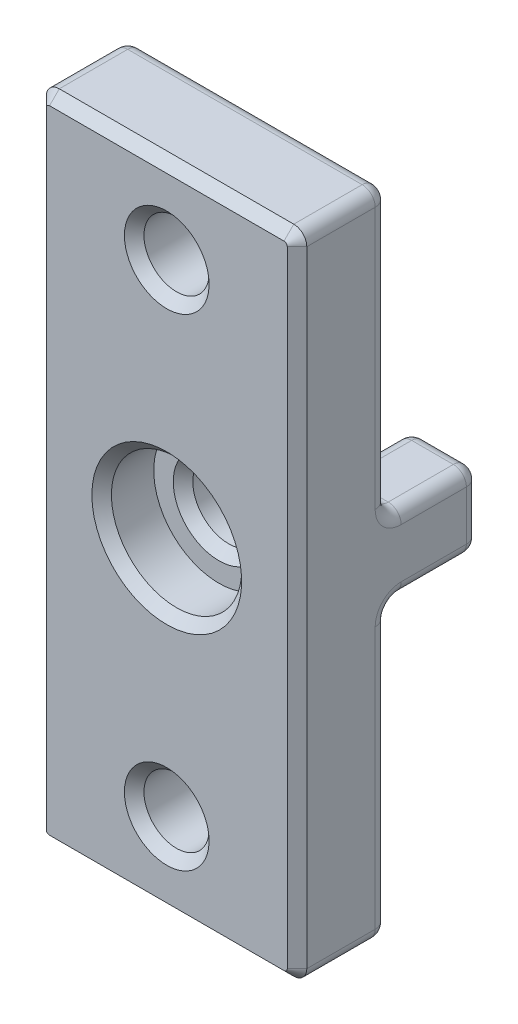
from build123d import *

# Parameters (mm, degrees)
EXTRUDE_1_DEPTH     = 7
EXTRUDE_1_2_DEPTH   = 7
EXTRUDE_1_3_DEPTH   = 7
EXTRUDE_1_4_DEPTH   = 7
SKETCH_3_R          = 2.75
SKETCH_3_R_2        = 2.4999999999999996
EXTRUDE_2_DEPTH     = 7
FILLET_1_R          = 1
SKETCH_5_R          = 5
CUT_EXTRUDE_2_DEPTH = 4
CHAMFER_1_SIZE      = 0.75


with BuildPart() as part:
    # Эскиз2 → Бобышка-Вытянуть1 (new body)
    with BuildSketch(Plane.XY):
        Polygon((-2.9, 10), (-2.8999999999999995, 4.800000000000013), (2.9000000000000004, 4.800000000000014), (2.9, 10), align=None)
    extrude(amount=-EXTRUDE_1_DEPTH)



with BuildPart() as body_2:
    # Эскиз2 → Extrude 1 2 (new body)
    with BuildSketch(Plane.XY):
        Polygon((10, 2.9000000000000004), (4.800000000000012, 2.9), (4.800000000000014, -2.9), (10, -2.8999999999999995), align=None)
    extrude(amount=-EXTRUDE_1_2_DEPTH)


with BuildPart() as body_3:
    # Эскиз2 → Extrude 1 3 (new body)
    with BuildSketch(Plane.XY):
        Polygon((2.9000000000000012, -10), (2.9000000000000004, -4.800000000000012), (-2.9, -4.800000000000014), (-2.8999999999999986, -10), align=None)
    extrude(amount=-EXTRUDE_1_3_DEPTH)


with BuildPart() as body_4:
    # Эскиз2 → Extrude 1 4 (new body)
    with BuildSketch(Plane.XY):
        Polygon((-10, -2.9000000000000017), (-4.800000000000012, -2.9000000000000004), (-4.800000000000015, 2.8999999999999995), (-10, 2.899999999999998), align=None)
    extrude(amount=-EXTRUDE_1_4_DEPTH)


with BuildPart() as part_1:
    add(part.part)

    add(body_2.part)  # Бобышка-Вытянуть2 merges body 2

    add(body_3.part)  # Бобышка-Вытянуть2 merges body 3

    add(body_4.part)  # Бобышка-Вытянуть2 merges body 4
    # Эскиз3 → Бобышка-Вытянуть2 (add)
    with BuildSketch(Plane.XY):
        with BuildLine():
            Line((-10.00000014901159, 24), (-10.000000149011584, -23.999999999999993))
            ThreePointArc((-10.000000149011584, -23.999999999999993), (-9.707106930198131, -24.70710678118654), (-9.000000149011584, -24.99999999999999))
            Line((-9.000000149011584, -24.99999999999999), (9.00000014901158, -24.99999999999999))
            ThreePointArc((9.00000014901158, -24.99999999999999), (9.707106930198124, -24.70710678118654), (10.00000014901158, -23.999999999999993))
            Line((10.00000014901158, -23.999999999999993), (10.000000149011589, 24))
            ThreePointArc((10.000000149011589, 24), (9.707106930198133, 24.707106781186546), (9.000000149011585, 25))
            Line((9.000000149011585, 25), (-9.000000149011589, 25))
            ThreePointArc((-9.000000149011589, 25), (-9.707106930198137, 24.70710678118655), (-10.00000014901159, 24))
        make_face()
        Circle(SKETCH_3_R, mode=Mode.SUBTRACT)
        with Locations((0, 18.500000000000004)):
            Circle(SKETCH_3_R_2, mode=Mode.SUBTRACT)
        with Locations(Location((0, -18.499999999999996, 0), (0, 0, 180))):
            Circle(SKETCH_3_R_2, mode=Mode.SUBTRACT)
    extrude(amount=EXTRUDE_2_DEPTH)

    # Скругление1
    # the kernel refuses this fillet: 1 mm, written as the material it takes off along each edge
    with BuildSketch(Plane(origin=(5.800000000000012, 1.9, -6), x_dir=(-1, -3.1e-16, 0), z_dir=(-9e-17, 1, 0))) as fillet_1_piece_1_section:
        Polygon((0, 0), (FILLET_1_R, 0), (FILLET_1_R, -FILLET_1_R), (0, -FILLET_1_R), align=None)
    fillet_1_piece_1 = extrude(amount=FILLET_1_R, mode=Mode.PRIVATE)
    fillet_1_piece_1 = fillet_1_piece_1 - Plane(origin=(5.800000000000012, 1.9, -6), x_dir=(0.7071067811865475, 0, 0.7071067811865475), z_dir=(-9e-17, 1, 0)) * Sphere(FILLET_1_R, mode=Mode.PRIVATE)
    add(fillet_1_piece_1, mode=Mode.SUBTRACT)
    with BuildSketch(Plane(origin=(5.800000000000014, -1.9000000000000006, -6), x_dir=(9e-17, -1, 0), z_dir=(-1, -3.1e-16, 0))) as fillet_1_piece_2_section:
        Polygon((0, 0), (FILLET_1_R, 0), (FILLET_1_R, -FILLET_1_R), (0, -FILLET_1_R), align=None)
    fillet_1_piece_2 = extrude(amount=FILLET_1_R, mode=Mode.PRIVATE)
    fillet_1_piece_2 = fillet_1_piece_2 - Plane(origin=(5.800000000000014, -1.9000000000000006, -6), x_dir=(0, 0.7071067811865475, 0.7071067811865475), z_dir=(-1, -3.1e-16, 0)) * Sphere(FILLET_1_R, mode=Mode.PRIVATE)
    add(fillet_1_piece_2, mode=Mode.SUBTRACT)
    with BuildSketch(Plane(origin=(1.9000000000000012, -9, -6), x_dir=(0, -1, 0), z_dir=(1, 1.7e-16, 0))) as fillet_1_piece_3_section:
        Polygon((0, 0), (FILLET_1_R, 0), (FILLET_1_R, FILLET_1_R), (0, FILLET_1_R), align=None)
    fillet_1_piece_3 = extrude(amount=FILLET_1_R, mode=Mode.PRIVATE)
    fillet_1_piece_3 = fillet_1_piece_3 - Plane(origin=(1.9000000000000012, -9, -6), x_dir=(0, 0.7071067811865475, 0.7071067811865475), z_dir=(1, 1.7e-16, 0)) * Sphere(FILLET_1_R, mode=Mode.PRIVATE)
    add(fillet_1_piece_3, mode=Mode.SUBTRACT)
    with BuildSketch(Plane(origin=(1.9000000000000004, -5.800000000000013, -6), x_dir=(-3.1e-16, 1, 0), z_dir=(1, 1.7e-16, 0))) as fillet_1_piece_4_section:
        Polygon((0, 0), (FILLET_1_R, 0), (FILLET_1_R, -FILLET_1_R), (0, -FILLET_1_R), align=None)
    fillet_1_piece_4 = extrude(amount=FILLET_1_R, mode=Mode.PRIVATE)
    fillet_1_piece_4 = fillet_1_piece_4 - Plane(origin=(1.9000000000000004, -5.800000000000013, -6), x_dir=(0, -0.7071067811865475, 0.7071067811865475), z_dir=(1, 1.7e-16, 0)) * Sphere(FILLET_1_R, mode=Mode.PRIVATE)
    add(fillet_1_piece_4, mode=Mode.SUBTRACT)
    with BuildSketch(Plane(origin=(-1.9000000000000001, -5.800000000000014, -6), x_dir=(-1, -2.6e-16, 0), z_dir=(-3.1e-16, 1, 0))) as fillet_1_piece_5_section:
        Polygon((0, 0), (FILLET_1_R, 0), (FILLET_1_R, -FILLET_1_R), (0, -FILLET_1_R), align=None)
    fillet_1_piece_5 = extrude(amount=FILLET_1_R, mode=Mode.PRIVATE)
    fillet_1_piece_5 = fillet_1_piece_5 - Plane(origin=(-1.9000000000000001, -5.800000000000014, -6), x_dir=(0.7071067811865475, 0, 0.7071067811865475), z_dir=(-3.1e-16, 1, 0)) * Sphere(FILLET_1_R, mode=Mode.PRIVATE)
    add(fillet_1_piece_5, mode=Mode.SUBTRACT)
    with BuildSketch(Plane(origin=(-1.8999999999999988, -9, -6), x_dir=(-1, -2.6e-16, 0), z_dir=(0, -1, 0))) as fillet_1_piece_6_section:
        Polygon((0, 0), (FILLET_1_R, 0), (FILLET_1_R, FILLET_1_R), (0, FILLET_1_R), align=None)
    fillet_1_piece_6 = extrude(amount=FILLET_1_R, mode=Mode.PRIVATE)
    fillet_1_piece_6 = fillet_1_piece_6 - Plane(origin=(-1.8999999999999988, -9, -6), x_dir=(0.7071067811865475, 0, 0.7071067811865475), z_dir=(0, -1, 0)) * Sphere(FILLET_1_R, mode=Mode.PRIVATE)
    add(fillet_1_piece_6, mode=Mode.SUBTRACT)
    with BuildSketch(Plane(origin=(-5.800000000000015, 1.899999999999999, -6), x_dir=(0, 0, -1), z_dir=(-2.6e-16, 1, 0))) as fillet_1_piece_7_section:
        Polygon((0, 0), (FILLET_1_R, 0), (FILLET_1_R, -FILLET_1_R), (0, -FILLET_1_R), align=None)
    fillet_1_piece_7 = extrude(amount=FILLET_1_R, mode=Mode.PRIVATE)
    fillet_1_piece_7 = fillet_1_piece_7 - Plane(origin=(-5.800000000000015, 1.899999999999999, -6), x_dir=(-0.7071067811865475, 0, 0.7071067811865475), z_dir=(-2.6e-16, 1, 0)) * Sphere(FILLET_1_R, mode=Mode.PRIVATE)
    add(fillet_1_piece_7, mode=Mode.SUBTRACT)
    with BuildSketch(Plane(origin=(-5.800000000000013, -1.9000000000000006, -6), x_dir=(2.6e-16, -1, 0), z_dir=(0, 0, -1))) as fillet_1_piece_8_section:
        Polygon((0, 0), (FILLET_1_R, 0), (FILLET_1_R, -FILLET_1_R), (-2e-16, -FILLET_1_R), align=None)
    fillet_1_piece_8 = extrude(amount=FILLET_1_R, mode=Mode.PRIVATE)
    fillet_1_piece_8 = fillet_1_piece_8 - Plane(origin=(-5.800000000000013, -1.9000000000000006, -6), x_dir=(-0.7071067811865478, 0.7071067811865472, 0), z_dir=(0, 0, -1)) * Sphere(FILLET_1_R, mode=Mode.PRIVATE)
    add(fillet_1_piece_8, mode=Mode.SUBTRACT)
    with BuildSketch(Plane(origin=(-1.9, 9, -6), x_dir=(0, 1, 0), z_dir=(0, 0, -1))) as fillet_1_piece_9_section:
        Polygon((0, 0), (FILLET_1_R, 0), (FILLET_1_R, -FILLET_1_R), (-9e-17, -FILLET_1_R), align=None)
    fillet_1_piece_9 = extrude(amount=FILLET_1_R, mode=Mode.PRIVATE)
    fillet_1_piece_9 = fillet_1_piece_9 - Plane(origin=(-1.9, 9, -6), x_dir=(0.7071067811865476, -0.7071067811865475, 0), z_dir=(0, 0, -1)) * Sphere(FILLET_1_R, mode=Mode.PRIVATE)
    add(fillet_1_piece_9, mode=Mode.SUBTRACT)
    with BuildSketch(Plane(origin=(-1.8999999999999995, 5.800000000000013, -6), x_dir=(1.5e-16, -1, 0), z_dir=(0, 0, -1))) as fillet_1_piece_10_section:
        Polygon((0, 0), (FILLET_1_R, 0), (FILLET_1_R, FILLET_1_R), (-7e-17, FILLET_1_R), align=None)
    fillet_1_piece_10 = extrude(amount=FILLET_1_R, mode=Mode.PRIVATE)
    fillet_1_piece_10 = fillet_1_piece_10 - Plane(origin=(-1.8999999999999995, 5.800000000000013, -6), x_dir=(0.7071067811865475, 0.7071067811865476, 0), z_dir=(0, 0, -1)) * Sphere(FILLET_1_R, mode=Mode.PRIVATE)
    add(fillet_1_piece_10, mode=Mode.SUBTRACT)
    with BuildSketch(Plane(origin=(1.9000000000000004, 5.800000000000014, -6), x_dir=(1.5e-16, -1, 0), z_dir=(0, 0, -1))) as fillet_1_piece_11_section:
        Polygon((0, 0), (FILLET_1_R, 0), (FILLET_1_R, -FILLET_1_R), (7e-17, -FILLET_1_R), align=None)
    fillet_1_piece_11 = extrude(amount=FILLET_1_R, mode=Mode.PRIVATE)
    fillet_1_piece_11 = fillet_1_piece_11 - Plane(origin=(1.9000000000000004, 5.800000000000014, -6), x_dir=(-0.7071067811865477, 0.7071067811865474, 0), z_dir=(0, 0, -1)) * Sphere(FILLET_1_R, mode=Mode.PRIVATE)
    add(fillet_1_piece_11, mode=Mode.SUBTRACT)
    with BuildSketch(Plane(origin=(1.9, 9, -6), x_dir=(0, 1, 0), z_dir=(0, 0, -1))) as fillet_1_piece_12_section:
        Polygon((0, 0), (FILLET_1_R, 0), (FILLET_1_R, FILLET_1_R), (9e-17, FILLET_1_R), align=None)
    fillet_1_piece_12 = extrude(amount=FILLET_1_R, mode=Mode.PRIVATE)
    fillet_1_piece_12 = fillet_1_piece_12 - Plane(origin=(1.9, 9, -6), x_dir=(-0.7071067811865475, -0.7071067811865475, 0), z_dir=(0, 0, -1)) * Sphere(FILLET_1_R, mode=Mode.PRIVATE)
    add(fillet_1_piece_12, mode=Mode.SUBTRACT)
    with BuildSketch(Plane(origin=(10, -5.3999999999999995, -7), x_dir=(0, 0, 1), z_dir=(0, 1, 0)), Plane(origin=(-10, 5.399999999999999, -7), x_dir=(0, 0, 1), z_dir=(0, -1, 0))) as fillet_1_piece_13:
        with BuildLine():
            CenterArc((FILLET_1_R, -FILLET_1_R), FILLET_1_R, 90, 90)
            Line((0, -FILLET_1_R), (0, 0))
            Line((0, 0), (FILLET_1_R, 0))
        make_face()
    extrude(amount=10.8, mode=Mode.SUBTRACT)
    with BuildSketch(Plane(origin=(12.5, 2.9000000000000004, -7), x_dir=(0, 0, 1), z_dir=(-1, -9e-17, 0)), Plane(origin=(-12.5, -2.900000000000002, -7), x_dir=(0, 0, 1), z_dir=(1, 2.6e-16, 0))) as fillet_1_piece_14:
        with BuildLine():
            CenterArc((FILLET_1_R, -FILLET_1_R), FILLET_1_R, 90, 90)
            Line((0, -FILLET_1_R), (0, 0))
            Line((0, 0), (FILLET_1_R, 0))
        make_face()
    extrude(amount=6.699999999999988, mode=Mode.SUBTRACT)
    with BuildSketch(Plane(origin=(0, -18.499999999999996, 0), x_dir=(-1, 0, 0), z_dir=(0, 1, 0))) as fillet_1_piece_15:
        with BuildLine():
            CenterArc((2.4999999999999996 + FILLET_1_R, FILLET_1_R), FILLET_1_R, 180, 90)
            Line((2.4999999999999996, FILLET_1_R), (2.4999999999999996, 0))
            Line((2.4999999999999996, 0), (2.4999999999999996 + FILLET_1_R, 0))
        make_face()
    revolve(axis=Axis((0, -18.499999999999996, 0), (0, 0, 1)), mode=Mode.SUBTRACT)
    with BuildSketch(Plane(origin=(0, 18.500000000000004, 0), x_dir=(1, 0, 0), z_dir=(0, -1, 0))) as fillet_1_piece_16:
        with BuildLine():
            CenterArc((2.4999999999999996 + FILLET_1_R, FILLET_1_R), FILLET_1_R, 180, 90)
            Line((2.4999999999999996, FILLET_1_R), (2.4999999999999996, 0))
            Line((2.4999999999999996, 0), (2.4999999999999996 + FILLET_1_R, 0))
        make_face()
    revolve(axis=Axis((0, 18.500000000000004, 0), (0, 0, 1)), mode=Mode.SUBTRACT)
    with BuildSketch(Plane(origin=(-1.73e-15, 3.47e-15, 0), x_dir=(1, 0, 0), z_dir=(0, -1, 0))) as fillet_1_piece_17:
        with BuildLine():
            CenterArc((2.75 + FILLET_1_R, FILLET_1_R), FILLET_1_R, 180, 90)
            Line((2.75, FILLET_1_R), (2.75, 0))
            Line((2.75, 0), (2.75 + FILLET_1_R, 0))
        make_face()
    revolve(axis=Axis((-1.73e-15, 3.47e-15, 0), (0, 0, 1)), mode=Mode.SUBTRACT)
    with BuildSketch(Plane(origin=(4.800000000000012, 1.8999999999999995, -7), x_dir=(0, 0, 1), z_dir=(3.1e-16, -1, 0))) as fillet_1_piece_18:
        with BuildLine():
            CenterArc((FILLET_1_R, -FILLET_1_R), FILLET_1_R, 90, 90)
            Line((0, -FILLET_1_R), (0, 0))
            Line((0, 0), (FILLET_1_R, 0))
        make_face()
    extrude(amount=3.8000000000000003, mode=Mode.SUBTRACT)
    with BuildSketch(Plane(origin=(2.9000000000000012, -9, -7), x_dir=(0, 0, 1), z_dir=(-1.7e-16, 1, 0))) as fillet_1_piece_19:
        with BuildLine():
            CenterArc((FILLET_1_R, -FILLET_1_R), FILLET_1_R, 90, 90)
            Line((0, -FILLET_1_R), (0, 0))
            Line((0, 0), (FILLET_1_R, 0))
        make_face()
    extrude(amount=3.1999999999999877, mode=Mode.SUBTRACT)
    with BuildSketch(Plane(origin=(2.9000000000000004, -4.800000000000012, 0), x_dir=(0, -1, 0), z_dir=(0, 0, -1))) as fillet_1_piece_20:
        with BuildLine():
            CenterArc((FILLET_1_R, FILLET_1_R), FILLET_1_R, 179.99999999999997, 90)
            Line((8.9e-16, FILLET_1_R), (0, 0))
            Line((0, 0), (FILLET_1_R, 0))
        make_face()
    extrude(amount=6, mode=Mode.SUBTRACT)
    with BuildSketch(Plane(origin=(2.9000000000000012, -10, 0), x_dir=(0, 1, 0), z_dir=(0, 0, -1)), Plane(origin=(-2.9, 10, 0), x_dir=(0, -1, 0), z_dir=(0, 0, -1))) as fillet_1_piece_21:
        with BuildLine():
            CenterArc((FILLET_1_R, -FILLET_1_R), FILLET_1_R, 90, 90)
            Line((0, -FILLET_1_R), (0, 0))
            Line((0, 0), (FILLET_1_R, 0))
        make_face()
    extrude(amount=6, mode=Mode.SUBTRACT)
    with BuildSketch(Plane(origin=(-2.8999999999999995, -5.800000000000014, -7), x_dir=(0, 0, 1), z_dir=(2.6e-16, -1, 0)), Plane(origin=(2.9000000000000004, 5.800000000000014, -7), x_dir=(0, 0, 1), z_dir=(-9e-17, 1, 0))) as fillet_1_piece_22:
        with BuildLine():
            CenterArc((FILLET_1_R, -FILLET_1_R), FILLET_1_R, 90, 90)
            Line((0, -FILLET_1_R), (0, 0))
            Line((0, 0), (FILLET_1_R, 0))
        make_face()
    extrude(amount=3.199999999999986, mode=Mode.SUBTRACT)
    with BuildSketch(Plane(origin=(-2.8999999999999986, -10, 0), x_dir=(1, 0, 0), z_dir=(0, 0, -1))) as fillet_1_piece_23:
        with BuildLine():
            CenterArc((FILLET_1_R, -FILLET_1_R), FILLET_1_R, 90, 90)
            Line((-4.4e-16, -FILLET_1_R), (0, 0))
            Line((0, 0), (FILLET_1_R, 0))
        make_face()
    extrude(amount=6, mode=Mode.SUBTRACT)
    with BuildSketch(Plane(origin=(1.9, -4.800000000000012, -7), x_dir=(0, 0, 1), z_dir=(-1, -3.1e-16, 0))) as fillet_1_piece_24:
        with BuildLine():
            CenterArc((FILLET_1_R, -FILLET_1_R), FILLET_1_R, 90, 90)
            Line((0, -FILLET_1_R), (0, 0))
            Line((0, 0), (FILLET_1_R, 0))
        make_face()
    extrude(amount=3.800000000000001, mode=Mode.SUBTRACT)
    with BuildSketch(Plane(origin=(-2.9, -4.800000000000014, 0), x_dir=(1, 0, 0), z_dir=(0, 0, -1))) as fillet_1_piece_25:
        with BuildLine():
            CenterArc((FILLET_1_R, FILLET_1_R), FILLET_1_R, 180, 90)
            Line((-4.4e-16, FILLET_1_R), (0, 0))
            Line((0, 0), (FILLET_1_R, 0))
        make_face()
    extrude(amount=6, mode=Mode.SUBTRACT)
    with BuildSketch(Plane(origin=(-1.899999999999999, -10, -7), x_dir=(0, 0, 1), z_dir=(1, 0, 0))) as fillet_1_piece_26:
        with BuildLine():
            CenterArc((FILLET_1_R, -FILLET_1_R), FILLET_1_R, 90, 90)
            Line((0, -FILLET_1_R), (0, 0))
            Line((0, 0), (FILLET_1_R, 0))
        make_face()
    extrude(amount=3.8000000000000003, mode=Mode.SUBTRACT)
    with BuildSketch(Plane(origin=(4.800000000000012, 2.9, 0), x_dir=(1, 0, 0), z_dir=(0, 0, -1))) as fillet_1_piece_27:
        with BuildLine():
            CenterArc((FILLET_1_R, FILLET_1_R), FILLET_1_R, 179.99999999999997, 90)
            Line((0, FILLET_1_R), (0, 0))
            Line((0, 0), (FILLET_1_R, 0))
        make_face()
    extrude(amount=6, mode=Mode.SUBTRACT)
    with BuildSketch(Plane(origin=(-5.800000000000015, 2.899999999999999, -7), x_dir=(0, 0, 1), z_dir=(-1, -2.6e-16, 0))) as fillet_1_piece_28:
        with BuildLine():
            CenterArc((FILLET_1_R, -FILLET_1_R), FILLET_1_R, 90, 90)
            Line((0, -FILLET_1_R), (0, 0))
            Line((0, 0), (FILLET_1_R, 0))
        make_face()
    extrude(amount=6.699999999999985, mode=Mode.SUBTRACT)
    with BuildSketch(Plane(origin=(-4.800000000000013, -1.9000000000000001, -7), x_dir=(0, 0, 1), z_dir=(-4.6e-16, 1, 0)), Plane(origin=(-1.8999999999999995, 4.800000000000013, -7), x_dir=(0, 0, 1), z_dir=(1, 1.5e-16, 0)), Plane(origin=(1.9, 10, -7), x_dir=(0, 0, 1), z_dir=(-1, 0, 0))) as fillet_1_piece_29:
        with BuildLine():
            CenterArc((FILLET_1_R, -FILLET_1_R), FILLET_1_R, 90, 90)
            Line((0, -FILLET_1_R), (0, 0))
            Line((0, 0), (FILLET_1_R, 0))
        make_face()
    extrude(amount=3.8, mode=Mode.SUBTRACT)
    with BuildSketch(Plane(origin=(-4.800000000000015, 2.8999999999999995, 0), x_dir=(8.9e-16, -1, 0), z_dir=(0, 0, -1))) as fillet_1_piece_30:
        with BuildLine():
            CenterArc((FILLET_1_R, FILLET_1_R), FILLET_1_R, 180, 90)
            Line((-1.33e-15, FILLET_1_R), (0, 0))
            Line((0, 0), (FILLET_1_R, 0))
        make_face()
    extrude(amount=6, mode=Mode.SUBTRACT)
    with BuildSketch(Plane(origin=(-4.800000000000012, -2.9000000000000004, 0), x_dir=(-1, -4.4e-16, 0), z_dir=(0, 0, -1))) as fillet_1_piece_31:
        with BuildLine():
            CenterArc((FILLET_1_R, FILLET_1_R), FILLET_1_R, 180, 90)
            Line((4.4e-16, FILLET_1_R), (0, 0))
            Line((0, 0), (FILLET_1_R, 0))
        make_face()
    extrude(amount=6, mode=Mode.SUBTRACT)
    with BuildSketch(Plane(origin=(4.800000000000014, -2.9, 0), x_dir=(0, 1, 0), z_dir=(0, 0, -1))) as fillet_1_piece_32:
        with BuildLine():
            CenterArc((FILLET_1_R, FILLET_1_R), FILLET_1_R, 180, 90)
            Line((-4.4e-16, FILLET_1_R), (0, 0))
            Line((0, 0), (FILLET_1_R, 0))
        make_face()
    extrude(amount=6, mode=Mode.SUBTRACT)
    with BuildSketch(Plane(origin=(-2.9, 9, -7), x_dir=(0, 0, 1), z_dir=(9e-17, -1, 0))) as fillet_1_piece_33:
        with BuildLine():
            CenterArc((FILLET_1_R, -FILLET_1_R), FILLET_1_R, 90, 90)
            Line((0, -FILLET_1_R), (0, 0))
            Line((0, 0), (FILLET_1_R, 0))
        make_face()
    extrude(amount=3.199999999999987, mode=Mode.SUBTRACT)
    with BuildSketch(Plane(origin=(-2.8999999999999995, 4.800000000000013, 0), x_dir=(0, 1, 0), z_dir=(0, 0, -1))) as fillet_1_piece_34:
        with BuildLine():
            CenterArc((FILLET_1_R, FILLET_1_R), FILLET_1_R, 180, 90)
            Line((0, FILLET_1_R), (0, 0))
            Line((0, 0), (FILLET_1_R, 0))
        make_face()
    extrude(amount=6, mode=Mode.SUBTRACT)
    with BuildSketch(Plane(origin=(2.9, 10, 0), x_dir=(-1, 0, 0), z_dir=(0, 0, -1))) as fillet_1_piece_35:
        with BuildLine():
            CenterArc((FILLET_1_R, -FILLET_1_R), FILLET_1_R, 90, 90)
            Line((0, -FILLET_1_R), (0, 0))
            Line((0, 0), (FILLET_1_R, 0))
        make_face()
    extrude(amount=6, mode=Mode.SUBTRACT)
    with BuildSketch(Plane(origin=(5.800000000000014, -2.9, -7), x_dir=(0, 0, 1), z_dir=(1, 9e-17, 0))) as fillet_1_piece_36:
        with BuildLine():
            CenterArc((FILLET_1_R, -FILLET_1_R), FILLET_1_R, 90, 90)
            Line((0, -FILLET_1_R), (0, 0))
            Line((0, 0), (FILLET_1_R, 0))
        make_face()
    extrude(amount=6.699999999999986, mode=Mode.SUBTRACT)
    with BuildSketch(Plane(origin=(2.9000000000000004, 4.800000000000014, 0), x_dir=(-1, 0, 0), z_dir=(0, 0, -1))) as fillet_1_piece_37:
        with BuildLine():
            CenterArc((FILLET_1_R, FILLET_1_R), FILLET_1_R, 180, 90)
            Line((0, FILLET_1_R), (0, 0))
            Line((0, 0), (FILLET_1_R, 0))
        make_face()
    extrude(amount=6, mode=Mode.SUBTRACT)
    # the kernel refuses this fillet: 1 mm, written as the material it adds along each edge
    with BuildSketch(Plane(origin=(12.5, 2.9000000000000004, 0), x_dir=(-9e-17, 1, 0), z_dir=(-1, -9e-17, 0))) as fillet_1_2_piece_1_section:
        with BuildLine():
            CenterArc((FILLET_1_R, FILLET_1_R), FILLET_1_R, 180, 90)
            Line((0, FILLET_1_R), (0, 0))
            Line((0, 0), (FILLET_1_R, 0))
        make_face()
    fillet_1_2_piece_1 = extrude(amount=6.699999999999988, mode=Mode.PRIVATE)
    fillet_1_2_piece_1 = split(fillet_1_2_piece_1, bisect_by=Plane(origin=(10.000000149011585, 3.126395114266824, -0.22639511426682526), z_dir=(-1, 1.9e-16, 0)), keep=Keep.TOP, mode=Mode.PRIVATE)
    add(fillet_1_2_piece_1)
    with BuildSketch(Plane(origin=(5.800000000000014, -2.9, 0), x_dir=(9e-17, -1, 0), z_dir=(1, 9e-17, 0))) as fillet_1_2_piece_2_section:
        with BuildLine():
            CenterArc((FILLET_1_R, FILLET_1_R), FILLET_1_R, 180, 90)
            Line((0, FILLET_1_R), (0, 0))
            Line((0, 0), (FILLET_1_R, 0))
        make_face()
    fillet_1_2_piece_2 = extrude(amount=6.699999999999986, mode=Mode.PRIVATE)
    fillet_1_2_piece_2 = split(fillet_1_2_piece_2, bisect_by=Plane(origin=(10.000000149011584, -3.1263951142668276, -0.22639511426682515), z_dir=(-1, 1.9e-16, 0)), keep=Keep.TOP, mode=Mode.PRIVATE)
    add(fillet_1_2_piece_2)
    with BuildSketch(Plane(origin=(4.800000000000012, 1.8999999999999995, 0), x_dir=(-1, -3.1e-16, 0), z_dir=(3.1e-16, -1, 0)), Plane(origin=(1.9, -4.800000000000012, 0), x_dir=(-3.1e-16, 1, 0), z_dir=(-1, -3.1e-16, 0))) as fillet_1_2_piece_3:
        with BuildLine():
            CenterArc((FILLET_1_R, FILLET_1_R), FILLET_1_R, 180, 90)
            Line((0, FILLET_1_R), (0, 0))
            Line((0, 0), (FILLET_1_R, 0))
        make_face()
    extrude(amount=3.8000000000000003)
    with BuildSketch(Plane(origin=(-1.899999999999999, -10, 0), x_dir=(0, -1, 0), z_dir=(1, 0, 0))) as fillet_1_2_piece_4:
        with BuildLine():
            CenterArc((FILLET_1_R, FILLET_1_R), FILLET_1_R, 180, 90)
            Line((0, FILLET_1_R), (0, 0))
            Line((0, 0), (FILLET_1_R, 0))
        make_face()
    extrude(amount=3.8000000000000003)
    with BuildSketch(Plane(origin=(2.9000000000000012, -9, 0), x_dir=(1, 1.7e-16, 0), z_dir=(-1.7e-16, 1, 0)), Plane(origin=(-2.9, 9, 0), x_dir=(-1, -9e-17, 0), z_dir=(9e-17, -1, 0))) as fillet_1_2_piece_5:
        with BuildLine():
            CenterArc((FILLET_1_R, FILLET_1_R), FILLET_1_R, 180, 90)
            Line((0, FILLET_1_R), (0, 0))
            Line((0, 0), (FILLET_1_R, 0))
        make_face()
    extrude(amount=3.199999999999987)
    with BuildSketch(Plane(origin=(-2.8999999999999995, -5.800000000000014, 0), x_dir=(-1, -2.6e-16, 0), z_dir=(2.6e-16, -1, 0)), Plane(origin=(2.9000000000000004, 5.800000000000014, 0), x_dir=(1, 9e-17, 0), z_dir=(-9e-17, 1, 0))) as fillet_1_2_piece_6:
        with BuildLine():
            CenterArc((FILLET_1_R, FILLET_1_R), FILLET_1_R, 180, 90)
            Line((0, FILLET_1_R), (0, 0))
            Line((0, 0), (FILLET_1_R, 0))
        make_face()
    extrude(amount=3.199999999999986)
    with BuildSketch(Plane(origin=(-12.5, -2.900000000000002, 0), x_dir=(2.6e-16, -1, 0), z_dir=(1, 2.6e-16, 0))) as fillet_1_2_piece_7_section:
        with BuildLine():
            CenterArc((FILLET_1_R, FILLET_1_R), FILLET_1_R, 180, 90)
            Line((0, FILLET_1_R), (0, 0))
            Line((0, 0), (FILLET_1_R, 0))
        make_face()
    fillet_1_2_piece_7 = extrude(amount=6.699999999999987, mode=Mode.PRIVATE)
    fillet_1_2_piece_7 = split(fillet_1_2_piece_7, bisect_by=Plane(origin=(-10.000000149011587, -3.126395114266824, -0.22639511426682526), z_dir=(1, 1.5e-16, 0)), keep=Keep.TOP, mode=Mode.PRIVATE)
    add(fillet_1_2_piece_7)
    with BuildSketch(Plane(origin=(-4.800000000000013, -1.9000000000000001, 0), x_dir=(1, 4.6e-16, 0), z_dir=(-4.6e-16, 1, 0))) as fillet_1_2_piece_8:
        with BuildLine():
            CenterArc((FILLET_1_R, FILLET_1_R), FILLET_1_R, 180, 90)
            Line((0, FILLET_1_R), (0, 0))
            Line((0, 0), (FILLET_1_R, 0))
        make_face()
    extrude(amount=3.8000000000000007)
    with BuildSketch(Plane(origin=(-5.800000000000015, 2.899999999999999, 0), x_dir=(-2.6e-16, 1, 0), z_dir=(-1, -2.6e-16, 0))) as fillet_1_2_piece_9_section:
        with BuildLine():
            CenterArc((FILLET_1_R, FILLET_1_R), FILLET_1_R, 180, 90)
            Line((0, FILLET_1_R), (0, 0))
            Line((0, 0), (FILLET_1_R, 0))
        make_face()
    fillet_1_2_piece_9 = extrude(amount=6.699999999999985, mode=Mode.PRIVATE)
    fillet_1_2_piece_9 = split(fillet_1_2_piece_9, bisect_by=Plane(origin=(-10.000000149011587, 3.126395114266824, -0.22639511426682565), z_dir=(1, 1.5e-16, 0)), keep=Keep.TOP, mode=Mode.PRIVATE)
    add(fillet_1_2_piece_9)
    with BuildSketch(Plane(origin=(1.9, 10, 0), x_dir=(0, 1, 0), z_dir=(-1, 0, 0)), Plane(origin=(-1.8999999999999995, 4.800000000000013, 0), x_dir=(1.5e-16, -1, 0), z_dir=(1, 1.5e-16, 0))) as fillet_1_2_piece_10:
        with BuildLine():
            CenterArc((FILLET_1_R, FILLET_1_R), FILLET_1_R, 180, 90)
            Line((0, FILLET_1_R), (0, 0))
            Line((0, 0), (FILLET_1_R, 0))
        make_face()
    extrude(amount=3.8)
    with BuildSketch(Plane(origin=(1.9000000000000001, 5.800000000000014, 0), x_dir=(2.2e-16, -1, 0), z_dir=(-1, -2.2e-16, 0))) as fillet_1_2_piece_11:
        with BuildLine():
            CenterArc((1 + FILLET_1_R, -FILLET_1_R), FILLET_1_R, 90, 90)
            Line((1, -FILLET_1_R), (1, 0))
            Line((1, 0), (1 + FILLET_1_R, 0))
        make_face()
    revolve(axis=Axis((1.9000000000000001, 5.800000000000014, 0), (0, 0, 1)), revolution_arc=89.99999999999999)
    with BuildSketch(Plane(origin=(1.9, 9, 0), x_dir=(0, 1, 0), z_dir=(-1, 0, 0))) as fillet_1_2_piece_12:
        with BuildLine():
            CenterArc((1 + FILLET_1_R, FILLET_1_R), FILLET_1_R, 180, 90)
            Line((1, FILLET_1_R), (1, 0))
            Line((1, 0), (1 + FILLET_1_R, 0))
        make_face()
    revolve(axis=Axis((1.9, 9, 0), (0, 0, -1)), revolution_arc=90)
    with BuildSketch(Plane(origin=(-1.8999999999999995, 5.800000000000013, 0), x_dir=(-1, 0, 0), z_dir=(0, 1, 0))) as fillet_1_2_piece_13:
        with BuildLine():
            CenterArc((1 + FILLET_1_R, -FILLET_1_R), FILLET_1_R, 90, 90)
            Line((1, -FILLET_1_R), (1, 0))
            Line((1, 0), (1 + FILLET_1_R, 0))
        make_face()
    revolve(axis=Axis((-1.8999999999999995, 5.800000000000013, 0), (0, 0, 1)), revolution_arc=90)
    with BuildSketch(Plane(origin=(-1.9, 9, 0), x_dir=(-1, 0, 0), z_dir=(0, -1, 0))) as fillet_1_2_piece_14:
        with BuildLine():
            CenterArc((1 + FILLET_1_R, FILLET_1_R), FILLET_1_R, 180, 90)
            Line((1, FILLET_1_R), (1, 0))
            Line((1, 0), (1 + FILLET_1_R, 0))
        make_face()
    revolve(axis=Axis((-1.9, 9, 0), (0, 0, -1)), revolution_arc=90)
    with BuildSketch(Plane(origin=(-5.800000000000014, 1.9, 0), x_dir=(1, 4.4e-16, 0), z_dir=(4.4e-16, -1, 0))) as fillet_1_2_piece_15:
        with BuildLine():
            CenterArc((1 + FILLET_1_R, -FILLET_1_R), FILLET_1_R, 90, 90)
            Line((1, -FILLET_1_R), (1, 0))
            Line((1, 0), (1 + FILLET_1_R, 0))
        make_face()
    revolve(axis=Axis((-5.800000000000014, 1.9, 0), (0, 0, 1)), revolution_arc=90.00000000000003)
    with BuildSketch(Plane(origin=(-5.800000000000013, -1.9000000000000008, 0), x_dir=(0, -1, 0), z_dir=(-1, 0, 0))) as fillet_1_2_piece_16:
        with BuildLine():
            CenterArc((1 + FILLET_1_R, -FILLET_1_R), FILLET_1_R, 90, 90)
            Line((1, -FILLET_1_R), (1, 0))
            Line((1, 0), (1 + FILLET_1_R, 0))
        make_face()
    revolve(axis=Axis((-5.800000000000013, -1.9000000000000008, 0), (0, 0, 1)), revolution_arc=90.00000000000004)
    with BuildSketch(Plane(origin=(-1.9000000000000001, -5.800000000000014, 0), x_dir=(-2.2e-16, 1, 0), z_dir=(1, 2.2e-16, 0))) as fillet_1_2_piece_17:
        with BuildLine():
            CenterArc((1 + FILLET_1_R, -FILLET_1_R), FILLET_1_R, 90, 90)
            Line((1, -FILLET_1_R), (1, 0))
            Line((1, 0), (1 + FILLET_1_R, 0))
        make_face()
    revolve(axis=Axis((-1.9000000000000001, -5.800000000000014, 0), (0, 0, 1)), revolution_arc=89.99999999999999)
    with BuildSketch(Plane(origin=(-1.899999999999999, -9, 0), x_dir=(0, -1, 0), z_dir=(1, 0, 0))) as fillet_1_2_piece_18:
        with BuildLine():
            CenterArc((1 + FILLET_1_R, FILLET_1_R), FILLET_1_R, 180, 90)
            Line((1, FILLET_1_R), (1, 0))
            Line((1, 0), (1 + FILLET_1_R, 0))
        make_face()
    revolve(axis=Axis((-1.899999999999999, -9, 0), (0, 0, -1)), revolution_arc=90)
    with BuildSketch(Plane(origin=(1.9000000000000004, -5.800000000000013, 0), x_dir=(1, 0, 0), z_dir=(0, -1, 0))) as fillet_1_2_piece_19:
        with BuildLine():
            CenterArc((1 + FILLET_1_R, -FILLET_1_R), FILLET_1_R, 90, 90)
            Line((1, -FILLET_1_R), (1, 0))
            Line((1, 0), (1 + FILLET_1_R, 0))
        make_face()
    revolve(axis=Axis((1.9000000000000004, -5.800000000000013, 0), (0, 0, 1)), revolution_arc=90.00000000000003)
    with BuildSketch(Plane(origin=(1.9000000000000012, -9, 0), x_dir=(1, 0, 0), z_dir=(0, 1, 0))) as fillet_1_2_piece_20:
        with BuildLine():
            CenterArc((1 + FILLET_1_R, FILLET_1_R), FILLET_1_R, 180, 90)
            Line((1, FILLET_1_R), (1, 0))
            Line((1, 0), (1 + FILLET_1_R, 0))
        make_face()
    revolve(axis=Axis((1.9000000000000012, -9, 0), (0, 0, -1)), revolution_arc=90)
    with BuildSketch(Plane(origin=(5.800000000000012, 1.9, 0), x_dir=(0, 1, 0), z_dir=(1, 0, 0))) as fillet_1_2_piece_21:
        with BuildLine():
            CenterArc((1 + FILLET_1_R, -FILLET_1_R), FILLET_1_R, 90, 90)
            Line((1, -FILLET_1_R), (1, 0))
            Line((1, 0), (1 + FILLET_1_R, 0))
        make_face()
    revolve(axis=Axis((5.800000000000012, 1.9, 0), (0, 0, 1)), revolution_arc=90.00000000000003)
    with BuildSketch(Plane(origin=(5.800000000000014, -1.9000000000000006, 0), x_dir=(-1, -2.2e-16, 0), z_dir=(-2.2e-16, 1, 0))) as fillet_1_2_piece_22:
        with BuildLine():
            CenterArc((1 + FILLET_1_R, -FILLET_1_R), FILLET_1_R, 90, 90)
            Line((1, -FILLET_1_R), (1, 0))
            Line((1, 0), (1 + FILLET_1_R, 0))
        make_face()
    revolve(axis=Axis((5.800000000000014, -1.9000000000000006, 0), (0, 0, 1)), revolution_arc=89.99999999999999)
    # the kernel refuses this fillet: 1 mm, written as the material it takes off along each edge
    with BuildSketch(Plane(origin=(9, -1.8999999999999995, -6), x_dir=(9e-17, -1, 0), z_dir=(1, 0, 0))) as fillet_1_3_piece_1_section:
        Polygon((0, 0), (FILLET_1_R, 0), (FILLET_1_R, FILLET_1_R), (0, FILLET_1_R), align=None)
    fillet_1_3_piece_1 = extrude(amount=FILLET_1_R, mode=Mode.PRIVATE)
    fillet_1_3_piece_1 = fillet_1_3_piece_1 - Plane(origin=(9, -1.8999999999999995, -6), x_dir=(0, 0.7071067811865475, 0.7071067811865475), z_dir=(1, 0, 0)) * Sphere(FILLET_1_R, mode=Mode.PRIVATE)
    add(fillet_1_3_piece_1, mode=Mode.SUBTRACT)
    with BuildSketch(Plane(origin=(9, 1.9000000000000004, -6), x_dir=(-9e-17, 1, 0), z_dir=(1, 0, 0))) as fillet_1_3_piece_2_section:
        Polygon((0, 0), (FILLET_1_R, 0), (FILLET_1_R, -FILLET_1_R), (0, -FILLET_1_R), align=None)
    fillet_1_3_piece_2 = extrude(amount=FILLET_1_R, mode=Mode.PRIVATE)
    fillet_1_3_piece_2 = fillet_1_3_piece_2 - Plane(origin=(9, 1.9000000000000004, -6), x_dir=(0, -0.7071067811865475, 0.7071067811865475), z_dir=(1, 0, 0)) * Sphere(FILLET_1_R, mode=Mode.PRIVATE)
    add(fillet_1_3_piece_2, mode=Mode.SUBTRACT)
    with BuildSketch(Plane(origin=(-9, 1.8999999999999986, -6), x_dir=(-2.6e-16, 1, 0), z_dir=(-1, 0, 0))) as fillet_1_3_piece_3_section:
        Polygon((0, 0), (FILLET_1_R, 0), (FILLET_1_R, FILLET_1_R), (0, FILLET_1_R), align=None)
    fillet_1_3_piece_3 = extrude(amount=FILLET_1_R, mode=Mode.PRIVATE)
    fillet_1_3_piece_3 = fillet_1_3_piece_3 - Plane(origin=(-9, 1.8999999999999986, -6), x_dir=(0, -0.7071067811865475, 0.7071067811865475), z_dir=(-1, 0, 0)) * Sphere(FILLET_1_R, mode=Mode.PRIVATE)
    add(fillet_1_3_piece_3, mode=Mode.SUBTRACT)
    with BuildSketch(Plane(origin=(-9, -1.9000000000000017, -6), x_dir=(2.6e-16, -1, 0), z_dir=(-1, 0, 0))) as fillet_1_3_piece_4_section:
        Polygon((0, 0), (FILLET_1_R, 0), (FILLET_1_R, -FILLET_1_R), (0, -FILLET_1_R), align=None)
    fillet_1_3_piece_4 = extrude(amount=FILLET_1_R, mode=Mode.PRIVATE)
    fillet_1_3_piece_4 = fillet_1_3_piece_4 - Plane(origin=(-9, -1.9000000000000017, -6), x_dir=(0, 0.7071067811865475, 0.7071067811865475), z_dir=(-1, 0, 0)) * Sphere(FILLET_1_R, mode=Mode.PRIVATE)
    add(fillet_1_3_piece_4, mode=Mode.SUBTRACT)
    with BuildSketch(Plane(origin=(-9.000000149011592, 24.000000000000004, 0), x_dir=(3.55e-15, 1, 0), z_dir=(1, -3.55e-15, 0))) as fillet_1_3_piece_5:
        with BuildLine():
            CenterArc((0.9999999999999964 - FILLET_1_R, FILLET_1_R), FILLET_1_R, 270, 90)
            Line((0.9999999999999964 - FILLET_1_R, -1.1e-16), (0.9999999999999964, 0))
            Line((0.9999999999999964, 0), (0.9999999999999964, FILLET_1_R))
        make_face()
    revolve(axis=Axis((-9.000000149011592, 24.000000000000004, 0), (0, 0, 1)), revolution_arc=90.00000000000041, mode=Mode.SUBTRACT)
    with BuildSketch(Plane(origin=(-10.00000014901159, 24, 0), x_dir=(0, 0, 1), z_dir=(1.5e-16, -1, 0))) as fillet_1_3_piece_6:
        with BuildLine():
            CenterArc((FILLET_1_R, -FILLET_1_R), FILLET_1_R, 90, 90)
            Line((-1.1e-16, -FILLET_1_R), (0, 0))
            Line((0, 0), (FILLET_1_R, 0))
        make_face()
    extrude(amount=20.1, mode=Mode.SUBTRACT)
    with BuildSketch(Plane(origin=(-9.000000149011587, -23.999999999999993, 0), x_dir=(-1, 0, 0), z_dir=(0, 1, 0))) as fillet_1_3_piece_7:
        with BuildLine():
            CenterArc((0.9999999999999964 - FILLET_1_R, FILLET_1_R), FILLET_1_R, 270, 90)
            Line((0.9999999999999964 - FILLET_1_R, -1.1e-16), (0.9999999999999964, 0))
            Line((0.9999999999999964, 0), (0.9999999999999964, FILLET_1_R))
        make_face()
    revolve(axis=Axis((-9.000000149011587, -23.999999999999993, 0), (0, 0, 1)), revolution_arc=90.0000000000002, mode=Mode.SUBTRACT)
    with BuildSketch(Plane(origin=(-9.000000149011584, -24.99999999999999, 0), x_dir=(0, 1, 0), z_dir=(1, 0, 0))) as fillet_1_3_piece_8:
        with BuildLine():
            CenterArc((FILLET_1_R, FILLET_1_R), FILLET_1_R, 180, 90)
            Line((0, FILLET_1_R), (0, 0))
            Line((0, 0), (FILLET_1_R, 0))
        make_face()
    extrude(amount=18.000000298023163, mode=Mode.SUBTRACT)
    with BuildSketch(Plane(origin=(9.00000014901158, -23.99999999999999, 0), x_dir=(0, -1, 0), z_dir=(-1, 0, 0))) as fillet_1_3_piece_9:
        with BuildLine():
            CenterArc((1 - FILLET_1_R, FILLET_1_R), FILLET_1_R, 270, 90)
            Line((1, FILLET_1_R), (1, 0))
            Line((1, 0), (1 - FILLET_1_R, 0))
        make_face()
    revolve(axis=Axis((9.00000014901158, -23.99999999999999, 0), (0, 0, 1)), revolution_arc=89.9999999999998, mode=Mode.SUBTRACT)
    with BuildSketch(Plane(origin=(10.00000014901158, -23.999999999999993, 0), x_dir=(-1, 1.9e-16, 0), z_dir=(1.9e-16, 1, 0))) as fillet_1_3_piece_10:
        with BuildLine():
            CenterArc((FILLET_1_R, FILLET_1_R), FILLET_1_R, 180, 90)
            Line((0, FILLET_1_R), (0, 0))
            Line((0, 0), (FILLET_1_R, 0))
        make_face()
    extrude(amount=20.099999999999994, mode=Mode.SUBTRACT)
    with BuildSketch(Plane(origin=(10.000000149011585, 3.8999999999999986, 0), x_dir=(-1, 1.9e-16, 0), z_dir=(1.9e-16, 1, 0))) as fillet_1_3_piece_11:
        with BuildLine():
            CenterArc((FILLET_1_R, FILLET_1_R), FILLET_1_R, 180, 90)
            Line((0, FILLET_1_R), (0, 0))
            Line((0, 0), (FILLET_1_R, 0))
        make_face()
    extrude(amount=20.1, mode=Mode.SUBTRACT)
    with BuildSketch(Plane(origin=(9.000000149011582, 23.999999999999993, 0), x_dir=(1, 7.11e-15, 0), z_dir=(7.11e-15, -1, 0))) as fillet_1_3_piece_12:
        with BuildLine():
            CenterArc((1.000000000000007 - FILLET_1_R, FILLET_1_R), FILLET_1_R, 270, 90)
            Line((1.000000000000007, FILLET_1_R), (1.000000000000007, 0))
            Line((1.000000000000007, 0), (1.000000000000007 - FILLET_1_R, 0))
        make_face()
    revolve(axis=Axis((9.000000149011582, 23.999999999999993, 0), (0, 0, 1)), revolution_arc=89.99999999999939, mode=Mode.SUBTRACT)
    with BuildSketch(Plane(origin=(9.000000149011585, 25, 0), x_dir=(0, -1, 0), z_dir=(-1, 0, 0))) as fillet_1_3_piece_13:
        with BuildLine():
            CenterArc((FILLET_1_R, FILLET_1_R), FILLET_1_R, 180, 90)
            Line((0, FILLET_1_R), (0, 0))
            Line((0, 0), (FILLET_1_R, 0))
        make_face()
    extrude(amount=18.000000298023174, mode=Mode.SUBTRACT)
    with BuildSketch(Plane(origin=(-10.000000149011587, -3.900000000000002, 0), x_dir=(0, 0, 1), z_dir=(1.5e-16, -1, 0))) as fillet_1_3_piece_14:
        with BuildLine():
            CenterArc((FILLET_1_R, -FILLET_1_R), FILLET_1_R, 90, 90)
            Line((-1.1e-16, -FILLET_1_R), (0, 0))
            Line((0, 0), (FILLET_1_R, 0))
        make_face()
    extrude(amount=20.09999999999999, mode=Mode.SUBTRACT)
    with BuildSketch(Plane(origin=(-10, -2.9000000000000017, -0.9999999999999999), x_dir=(0, 1, 0), z_dir=(0, 0, -1)), Plane(origin=(10, 2.9000000000000004, -0.9999999999999999), x_dir=(0, -1, 0), z_dir=(0, 0, -1))) as fillet_1_3_piece_15:
        with BuildLine():
            CenterArc((FILLET_1_R, FILLET_1_R), FILLET_1_R, 180, 90)
            Line((0, FILLET_1_R), (0, 0))
            Line((0, 0), (FILLET_1_R, 0))
        make_face()
    extrude(amount=5, mode=Mode.SUBTRACT)
    with BuildSketch(Plane(origin=(-10, 2.899999999999998, -0.9999999999999999), x_dir=(0, -1, 0), z_dir=(0, 0, -1))) as fillet_1_3_piece_16:
        with BuildLine():
            CenterArc((FILLET_1_R, -FILLET_1_R), FILLET_1_R, 90, 90)
            Line((-4.4e-16, -FILLET_1_R), (0, 0))
            Line((0, 0), (FILLET_1_R, 0))
        make_face()
    extrude(amount=5, mode=Mode.SUBTRACT)
    with BuildSketch(Plane(origin=(10, -2.8999999999999995, -0.9999999999999999), x_dir=(0, 1, 0), z_dir=(0, 0, -1))) as fillet_1_3_piece_17:
        with BuildLine():
            CenterArc((FILLET_1_R, -FILLET_1_R), FILLET_1_R, 90, 90)
            Line((0, -FILLET_1_R), (0, 0))
            Line((0, 0), (FILLET_1_R, 0))
        make_face()
    extrude(amount=5, mode=Mode.SUBTRACT)
    with BuildSketch(Plane(origin=(10.000000149011584, -3.8999999999999995, -1), x_dir=(0, 0, 1), z_dir=(9e-17, -1, 0))) as fillet_1_3_piece_18:
        with BuildLine():
            CenterArc((1 + FILLET_1_R, FILLET_1_R), FILLET_1_R, 180, 90)
            Line((1 + FILLET_1_R, 0), (1, 0))
            Line((1, 0), (1, FILLET_1_R))
        make_face()
    revolve(axis=Axis((10.000000149011584, -3.8999999999999995, -1), (-1, -9e-17, 0)), revolution_arc=90, mode=Mode.SUBTRACT)
    with BuildSketch(Plane(origin=(10.000000149011584, 3.9000000000000004, -1), x_dir=(0, 0, 1), z_dir=(-9e-17, 1, 0))) as fillet_1_3_piece_19:
        with BuildLine():
            CenterArc((1 + FILLET_1_R, -FILLET_1_R), FILLET_1_R, 90, 90)
            Line((1 + FILLET_1_R, 0), (1, 0))
            Line((1, 0), (1, -FILLET_1_R))
        make_face()
    revolve(axis=Axis((10.000000149011584, 3.9000000000000004, -1), (1, 9e-17, 0)), revolution_arc=90, mode=Mode.SUBTRACT)
    with BuildSketch(Plane(origin=(-10.000000149011587, 3.899999999999998, -1), x_dir=(0, 0, 1), z_dir=(-2.6e-16, 1, 0))) as fillet_1_3_piece_20:
        with BuildLine():
            CenterArc((1 + FILLET_1_R, FILLET_1_R), FILLET_1_R, 180, 90)
            Line((1, FILLET_1_R), (1, 0))
            Line((1, 0), (1 + FILLET_1_R, 0))
        make_face()
    revolve(axis=Axis((-10.000000149011587, 3.899999999999998, -1), (1, 2.6e-16, 0)), revolution_arc=90, mode=Mode.SUBTRACT)
    with BuildSketch(Plane(origin=(-10.000000149011589, -3.9000000000000017, -1), x_dir=(0, 0, 1), z_dir=(2.6e-16, -1, 0))) as fillet_1_3_piece_21:
        with BuildLine():
            CenterArc((1 + FILLET_1_R, -FILLET_1_R), FILLET_1_R, 90, 89.99999999999989)
            Line((1, -FILLET_1_R), (1, 0))
            Line((1, 0), (1 + FILLET_1_R, -1.78e-15))
        make_face()
    revolve(axis=Axis((-10.000000149011589, -3.9000000000000017, -1), (-1, -2.6e-16, 0)), revolution_arc=90, mode=Mode.SUBTRACT)

    # Эскиз5 → Вырез-Вытянуть2 (cut)
    with BuildSketch(Plane.XY.offset(7)):
        Circle(SKETCH_5_R)
    extrude(amount=-CUT_EXTRUDE_2_DEPTH, mode=Mode.SUBTRACT)

    # Фаска1
    chamfer_1_edges = [part_1.edges().sort_by_distance(p)[0] for p in [
        (-2.7500000000000018, 1.91e-15, 3),
        (-5, 6.1e-16, 7),
        (-9.707106930198139, 24.70710678118655, 7),
        (-10.000000149011587, 3.55e-15, 7),
        (-9.707106930198131, -24.70710678118654, 7),
        (-1.78e-15, -24.99999999999999, 7),
        (9.707106930198126, -24.70710678118654, 7),
        (10.000000149011584, 3.55e-15, 7),
        (9.707106930198133, 24.707106781186546, 7),
        (-1.78e-15, 25, 7),
        (-2.4999999999999996, 18.500000000000004, 7),
        (2.4999999999999996, -18.499999999999996, 7),
    ]]
    chamfer(chamfer_1_edges, length=CHAMFER_1_SIZE)


solid = part_1.part
